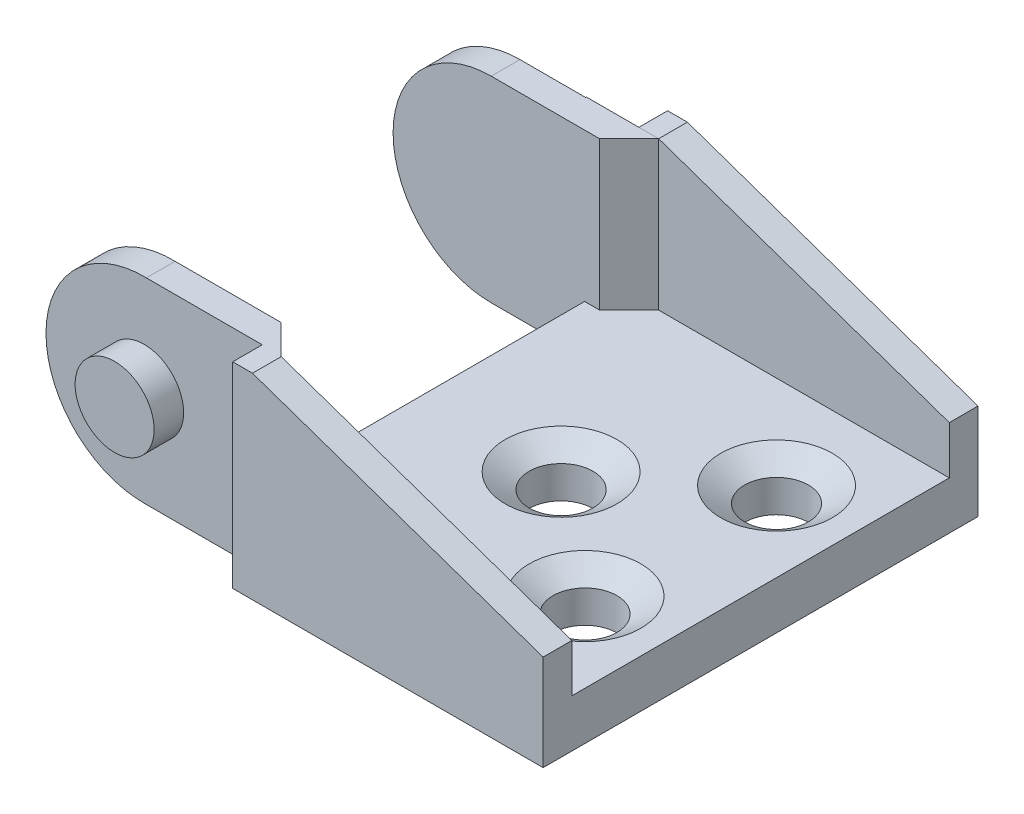
from build123d import *
from build123d.topology import SkipClean

# Parameters (mm, degrees)
PROFILEBOSS_EXTRUDE1_DEPTH           = 33
SKETCH2_OUTSIDE_W                    = 43.906
SKETCH2_OUTSIDE_H                    = 23.206
SIDEPROFILECUT_EXTRUDE1_DEPTH        = 45.529231972
SKETCH3_W                            = 11.132045058
SKETCH3_H                            = 23.65
BOTTOMCUT_EXTRUDE2_DEPTH             = 44.795576261
DRAGLINKMOUNTHOLESSKETCH4_R          = 2
DRAGLINKMOUNTHOLESCUT_EXTRUDE3_DEPTH = 44.795576261
CHAMFER1_SIZE                        = 1.5
CHAMFER1_SIZE2                       = 0.97411139
RIGHTINNERBOSS_EXTRUDE3_START        = 1.85
RIGHTINNERBOSS_EXTRUDE3_DEPTH        = 1.85
LEFTINNERBOSS_EXTRUDE4_DEPTH         = 1.85
RIGHTOUTERCIRCLESKETCH7_R            = 2.5
RIGHTOUTERCIRCLECUT_EXTRUDE4_DEPTH   = 1.85
LEFTOUTERCIRCLECUT_EXTRUDE5_START    = -1.85
SKETCH8_R                            = 2.475
LEFTOUTERCIRCLECUT_EXTRUDE5_DEPTH    = 1.85
CHAMFER2_SIZE                        = 1.85


with BuildPart() as part:
    # Sketch1 → ProfileBoss-Extrude1 (new body)
    with BuildSketch(Plane(origin=(0, 0, 0), x_dir=(0, 0, -1), z_dir=(1, 0, 0))):
        Polygon((0, 12.3), (0, 0), (27.25, 0), (27.25, 12.3), (25.45, 12.3), (25.45, 3), (1.8, 3), (1.8, 12.3), align=None)
    extrude(amount=PROFILEBOSS_EXTRUDE1_DEPTH)

    # Sketch2 outside → SideProfileCut-Extrude1 (cut, through all)
    with BuildSketch(Plane.XY):
        with Locations((16.5, 6.15)):
            Rectangle(SKETCH2_OUTSIDE_W, SKETCH2_OUTSIDE_H)
        with BuildLine():
            Line((14.789600469, 12.3), (33, 6))
            Line((33, 6), (33, 0))
            Line((33, 0), (6.15, 0))
            ThreePointArc((6.15, 0), (0.000396167, 6.219804731), (6.289600469, 12.298415382))
            Line((6.289600469, 12.298415382), (14.789600469, 12.3))
        make_face(mode=Mode.SUBTRACT)
    extrude(amount=-SIDEPROFILECUT_EXTRUDE1_DEPTH, mode=Mode.SUBTRACT)

    # Sketch3 → BottomCut-Extrude2 (cut, through all)
    with BuildSketch(Plane(origin=(0, 3, 0), x_dir=(1, 0, 0), z_dir=(0, 1, 0))):
        with Locations((6.433977471, 13.625)):
            Rectangle(SKETCH3_W, SKETCH3_H)
    extrude(amount=-BOTTOMCUT_EXTRUDE2_DEPTH, mode=Mode.SUBTRACT)

    # DragLinkMountHolesSketch4 → DragLinkMountHolesCut-Extrude3 (cut, through all)
    with BuildSketch(Plane(origin=(0, 3, 0), x_dir=(1, 0, 0), z_dir=(0, 1, 0))):
        with Locations(Location((28, 19.625, 0), (0, 0, 270))):
            Circle(DRAGLINKMOUNTHOLESSKETCH4_R)
        with Locations(Location((28, 7.625, 0), (0, 0, 270))):
            Circle(DRAGLINKMOUNTHOLESSKETCH4_R)
        with Locations(Location((20.5, 13.625, 0), (0, 0, 270))):
            Circle(DRAGLINKMOUNTHOLESSKETCH4_R)
    extrude(amount=-DRAGLINKMOUNTHOLESCUT_EXTRUDE3_DEPTH, mode=Mode.SUBTRACT)

    # Chamfer1
    chamfer1_edges = [part.edges().sort_by_distance(p)[0] for p in [
        (28, 3, -21.625),
        (28, 3, -9.625),
        (20.5, 3, -15.625),
    ]]
    chamfer1_side = [part.faces().sort_by_distance(p)[0] for p in [
        (12.316278754, 3, -13.625),
    ]]
    chamfer(chamfer1_edges, length=CHAMFER1_SIZE, length2=CHAMFER1_SIZE2, reference=chamfer1_side[0])

    # Sketch11 → RightInnerBoss-Extrude3 (add)
    with BuildSketch(Plane.XY.offset(-25.45).offset(RIGHTINNERBOSS_EXTRUDE3_START)):
        with BuildLine():
            Line((14.789600469, 12.3), (6.15, 12.3))
            ThreePointArc((6.15, 12.3), (0, 6.15), (6.15, 0))
            Line((6.15, 0), (14.789600469, 0))
            Line((14.789600469, 0), (14.789600469, 12.3))
        make_face()
    extrude(amount=-RIGHTINNERBOSS_EXTRUDE3_DEPTH)

    # Sketch12 → LeftInnerBoss-Extrude4 (add)
    with SkipClean():  # the faces are left unmerged after this step: merging them gives an invalid solid
        with BuildSketch(Plane(origin=(0, 0, -1.8), x_dir=(-1, 0, 0), z_dir=(0, 0, -1))):
            with BuildLine():
                Line((-14.789600469, 12.3), (-6.289600469, 12.298415382))
                ThreePointArc((-6.289600469, 12.298415382), (-0.000396167, 6.219804731), (-6.15, 0))
                Line((-6.15, 0), (-14.789600469, 0))
                Line((-14.789600469, 0), (-14.789600469, 12.3))
            make_face()
        extrude(amount=LEFTINNERBOSS_EXTRUDE4_DEPTH)

    # RightOuterCircleSketch7 → RightOuterCircleCut-Extrude4 (cut)
    with SkipClean():  # the faces are left unmerged after this step: merging them gives an invalid solid
        with BuildSketch(Plane(origin=(0, 0, -27.25), x_dir=(-1, 0, 0), z_dir=(0, 0, -1))):
            with BuildLine():
                Line((-13.55, 12.299768907), (-10.266779115, 12.29915683))
                ThreePointArc((-10.266779115, 12.29915683), (1.249999961, 6.150757924), (-10.265519408, 0))
                Line((-10.265519408, 0), (-13.55, 0))
                Line((-13.55, 0), (-13.55, 12.299768907))
            make_face()
            with Locations((-6.15, 6.15)):
                Circle(RIGHTOUTERCIRCLESKETCH7_R, mode=Mode.SUBTRACT)
        extrude(amount=-RIGHTOUTERCIRCLECUT_EXTRUDE4_DEPTH, mode=Mode.SUBTRACT)

    # Sketch8 → LeftOuterCircleCut-Extrude5 (cut)
    with BuildSketch(Plane.XY.offset(LEFTOUTERCIRCLECUT_EXTRUDE5_START)):
        with BuildLine():
            Line((13.550000004, 12.299768907), (10.266779119, 12.29915683))
            ThreePointArc((10.266779119, 12.29915683), (-1.249999964, 6.150757924), (10.265519413, 0))
            Line((10.265519413, 0), (13.548740355, 0))
            Line((13.548740355, 0), (13.550000004, 12.299768907))
        make_face()
        with Locations((6.15, 6.15)):
            Circle(SKETCH8_R, mode=Mode.SUBTRACT)
    extrude(amount=LEFTOUTERCIRCLECUT_EXTRUDE5_DEPTH, mode=Mode.SUBTRACT)

    # Chamfer2
    chamfer2_edges = [part.edges().sort_by_distance(p)[0] for p in [
        (14.789600469, 7.65, -23.6),
        (14.789600469, 7.65, -3.65),
    ]]
    chamfer(chamfer2_edges, length=CHAMFER2_SIZE - 0.0001)  # a hair under: the kernel refuses the full size


solid = part.part
